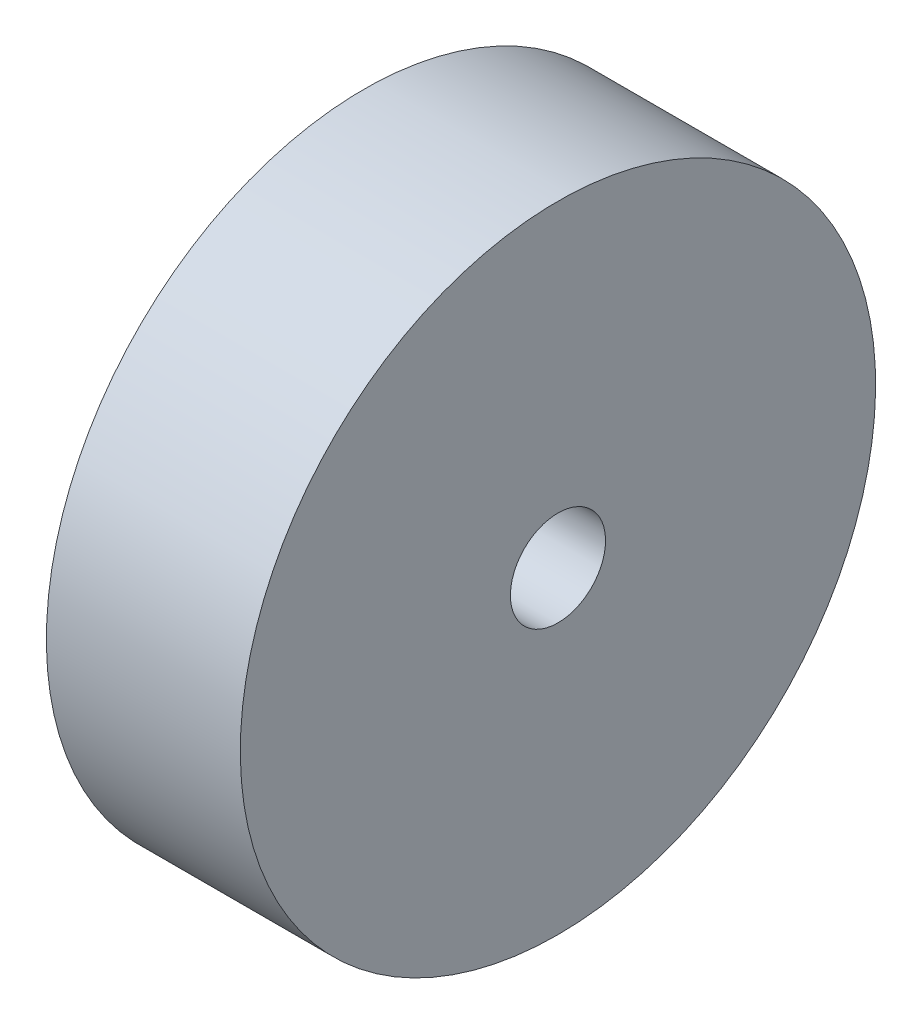
from build123d import *

# Parameters (mm, degrees)
SKETCH2_W = 26.5
SKETCH2_H = 36.9


with BuildPart() as part:
    # Sketch2 → Revolve1 (revolve)
    with BuildSketch(Plane.XY):
        with Locations((0, 24.95)):
            Rectangle(SKETCH2_W, SKETCH2_H)
    revolve(axis=Axis((-78.877853563, 0, 0), (1, 0, 0)))


solid = part.part
